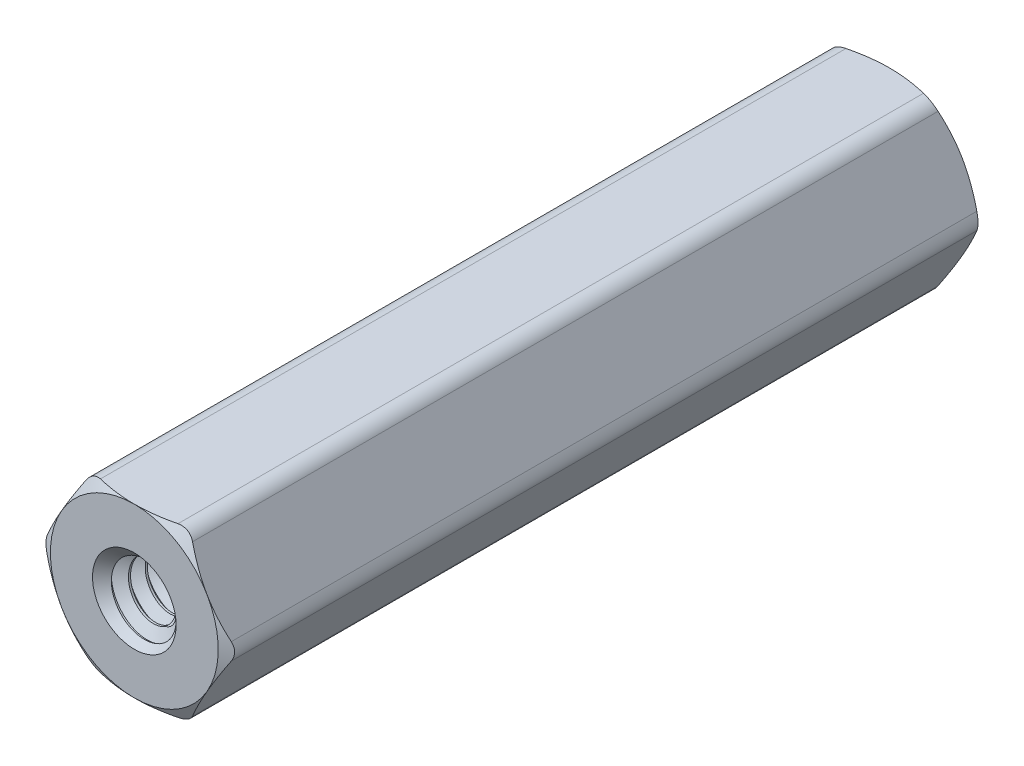
from build123d import *

# Parameters (mm, degrees)
SKETCH4_R           = 2.2987
BOSS_EXTRUDE1_DEPTH = 14.2875
SKETCH5_OUTSIDE_W   = 119.234
SKETCH5_OUTSIDE_H   = 118.252
SKETCH5_OUTSIDE_R   = 3.175
CUT_EXTRUDE1_DEPTH  = 29.983652001
CUT_EXTRUDE1_DRAFT  = -60
SKETCH6_OUTSIDE_W   = 119.234
SKETCH6_OUTSIDE_H   = 118.252
SKETCH6_OUTSIDE_R   = 3.175
CUT_EXTRUDE2_DEPTH  = 29.983652001
CUT_EXTRUDE2_DRAFT  = -60
FILLET1_R           = 0.635
BOSS_EXTRUDE2_START = -6.35
SKETCH7_R           = 1.58115
BOSS_EXTRUDE2_DEPTH = 6.35
SKETCH8_W           = 6.35
SKETCH8_H           = 1.4224
CUT_SWEEP1_PITCH    = 0.635
CIRPATTERN1_COUNT   = 2


with BuildPart() as part:
    # Sketch3 → Revolve1 (revolve)
    with BuildSketch(Plane(origin=(0, 0, 0), x_dir=(0, 0, -1), z_dir=(1, 0, 0))):
        Polygon((-14.12875, 1.4224), (-7.9375, 1.4224), (-7.9375, 0), (7.9375, 0), (7.9375, 1.4224), (14.2875, 1.4224), (14.2875, 3.175), (0, 3.175), (-14.2875, 3.175), (-14.2875, 1.58115), align=None)
        Polygon((-14.12875, 1.4224), (-7.9375, 1.4224), (-7.9375, 0), (7.9375, 0), (7.9375, 1.4224), (14.2875, 1.4224), (14.2875, 3.175), (0, 3.175), (-14.2875, 3.175), (-14.2875, 1.58115), align=None)
    revolve(axis=Axis((0, 0, 7.9375), (0, 0, 1)))

    # Sketch4 → Boss-Extrude1 (add, symmetric)
    with BuildSketch(Plane.XY):
        Polygon((-1.833087105, 3.175), (-3.666174209, 0), (-1.833087105, -3.175), (1.833087105, -3.175), (3.666174209, 0), (1.833087105, 3.175), align=None)
        Circle(SKETCH4_R, mode=Mode.SUBTRACT)
    extrude(amount=BOSS_EXTRUDE1_DEPTH, both=True)


with BuildPart() as cut_extrude1_tool:
    # Sketch5 outside → Cut-Extrude1 (with draft: the straight prism first)
    with BuildSketch(Plane.XY.offset(14.2875)):
        Rectangle(SKETCH5_OUTSIDE_W, SKETCH5_OUTSIDE_H)
        Circle(SKETCH5_OUTSIDE_R, mode=Mode.SUBTRACT)
    extrude(amount=-CUT_EXTRUDE1_DEPTH)
    # Cut-Extrude1: the draft: its side faces are tilted about the plane it starts from
    cut_extrude1_sides = [cut_extrude1_tool.faces().sort_by_distance(p)[0] for p in [
        (0, -59.126, -0.704326001),
        (59.617, 0, -0.704326001),
        (0, 59.126, -0.704326001),
        (-59.617, 0, -0.704326001),
        (-3.175, 0, -0.704326001),
    ]]
    draft(cut_extrude1_sides, Plane.XY.offset(14.2875), CUT_EXTRUDE1_DRAFT)


with BuildPart() as part_1:
    add(part.part)

    # Cut-Extrude1: cut by cut_extrude1_tool
    add(cut_extrude1_tool.part, mode=Mode.SUBTRACT)


with BuildPart() as cut_extrude2_tool:
    # Sketch6 outside → Cut-Extrude2 (with draft: the straight prism first)
    with BuildSketch(Plane(origin=(0, 0, -14.2875), x_dir=(-1, 0, 0), z_dir=(0, 0, -1))):
        Rectangle(SKETCH6_OUTSIDE_W, SKETCH6_OUTSIDE_H)
        Circle(SKETCH6_OUTSIDE_R, mode=Mode.SUBTRACT)
    extrude(amount=-CUT_EXTRUDE2_DEPTH)
    # Cut-Extrude2: the draft: its side faces are tilted about the plane it starts from
    cut_extrude2_sides = [cut_extrude2_tool.faces().sort_by_distance(p)[0] for p in [
        (0, -59.126, 0.704326001),
        (-59.617, 0, 0.704326001),
        (0, 59.126, 0.704326001),
        (59.617, 0, 0.704326001),
        (3.175, 0, 0.704326001),
    ]]
    draft(cut_extrude2_sides, Plane(origin=(0, 0, -14.2875), x_dir=(-1, 0, 0), z_dir=(0, 0, -1)), CUT_EXTRUDE2_DRAFT)


with BuildPart() as part_2:
    add(part_1.part)

    # Cut-Extrude2: cut by cut_extrude2_tool
    add(cut_extrude2_tool.part, mode=Mode.SUBTRACT)

    # Fillet1
    fillet1_edges = [part_2.edges().sort_by_distance(p)[0] for p in [
        (1.833087105, 3.175, 0),
        (-3.666174209, 0, 0),
        (-1.833087105, -3.175, 0),
        (1.833087105, -3.175, 0),
        (3.666174209, 0, 0),
        (-1.833087105, 3.175, 0),
    ]]
    fillet(fillet1_edges, radius=FILLET1_R)

    # Split1
    split(bisect_by=Plane.XY, keep=Keep.TOP)

    # Sketch7 → Boss-Extrude2 (add)
    with BuildSketch(Plane(origin=(0, 0, 7.9375), x_dir=(-1, 0, 0), z_dir=(0, 0, -1)).offset(BOSS_EXTRUDE2_START)):
        Circle(SKETCH7_R)
    extrude(amount=BOSS_EXTRUDE2_DEPTH)


with BuildPart() as body_2:
    # Sketch8 → Revolve2 (revolve)
    with BuildSketch(Plane(origin=(0, 0, 0), x_dir=(0, 0, -1), z_dir=(1, 0, 0))):
        with Locations((-11.1125, 0.7112)):
            Rectangle(SKETCH8_W, SKETCH8_H)
    revolve(axis=Axis((0, 0, 7.9375), (0, 0, 1)))

    # Cut-Sweep1: the profile of Sketch10 screwed along a right-hand helix of 11 turns, 6 arcs to a turn; built about Z, then put on its axis
    cut_sweep1_z = Axis((0, 0, 0), (0, 0, 1))
    cut_sweep1_corners = [(1.009955401, 0, -0.3175), (1.009955401, 0, -0.238125), (1.456770383, 0, 0.01984375), (1.456770383, 0, -0.57546875)]
    with BuildLine(mode=Mode.PRIVATE) as cut_sweep1_profile:
        Line(cut_sweep1_corners[0], cut_sweep1_corners[1])
        Line(cut_sweep1_corners[1], cut_sweep1_corners[2])
        Line(cut_sweep1_corners[2], cut_sweep1_corners[3])
        Line(cut_sweep1_corners[3], cut_sweep1_corners[0])
    cut_sweep1_cap = Face(cut_sweep1_profile.wire())
    cut_sweep1_turn_angles = [0, 30, 60, 90, 120, 150, 180, 210, 240, 270, 300, 330, 360]
    cut_sweep1_turn_weights = [1, 0.8660254037844387, 1, 0.8660254037844387, 1, 0.8660254037844387, 1, 0.8660254037844387, 1, 0.8660254037844387, 1, 0.8660254037844387, 1]
    cut_sweep1_turn_rails = [Edge.make_bspline([Vector(p[0], p[1], 0).rotate(cut_sweep1_z, cut_sweep1_turn_angles[k]) / cut_sweep1_turn_weights[k] + Vector(0, 0, p[2] + CUT_SWEEP1_PITCH * cut_sweep1_turn_angles[k] / 360) for k in range(13)], [0, 0, 0, 1, 1, 2, 2, 3, 3, 4, 4, 5, 5, 6, 6, 6], 2, cut_sweep1_turn_weights) for p in cut_sweep1_corners]
    cut_sweep1_turn_sides = [Face.make_surface_from_curves(cut_sweep1_turn_rails[p[0]], cut_sweep1_turn_rails[p[1]]) for p in [(0, 1), (1, 2), (2, 3), (3, 0)]]
    cut_sweep1 = Plane(origin=(0, 0, 14.2875), x_dir=(0, 1, 0), z_dir=(0, 0, -1)) * Solid(Shell([*[p.moved(Location((0, 0, CUT_SWEEP1_PITCH * i))) for i in range(11) for p in cut_sweep1_turn_sides], cut_sweep1_cap, cut_sweep1_cap.rotate(cut_sweep1_z, 3960).moved(Location((0, 0, CUT_SWEEP1_PITCH * 3960 / 360)))]))
    add(cut_sweep1, mode=Mode.SUBTRACT)


with BuildPart() as part_3:
    add(part_2.part)

    # Combine1: cut body 2
    add(body_2.part, mode=Mode.SUBTRACT)

    # Cut-Extrude3 cone 1 section (through the dimple's axis) → Cut-Extrude3 (revolve, cut)
    with BuildSketch(Plane(origin=(0, 0, 14.2875), x_dir=(0, -1, 0), z_dir=(1, 0, 0))):
        Polygon((0, 0), (1.58115, 0), (0, 1.58115), align=None)
    revolve(axis=Axis((0, 0, 14.2875), (0, 0, -1)), mode=Mode.SUBTRACT)


with BuildPart() as cirpattern1_1:
    # CirPattern1: pattern copy
    add(part_3.part.rotate(Axis((0, 0, 0), (1, 0, 0)), 1 * 360 / CIRPATTERN1_COUNT))


with BuildPart() as part_4:
    add(part_3.part)

    # Combine2: union CirPattern1_1
    add(cirpattern1_1.part)


solid = part_4.part
